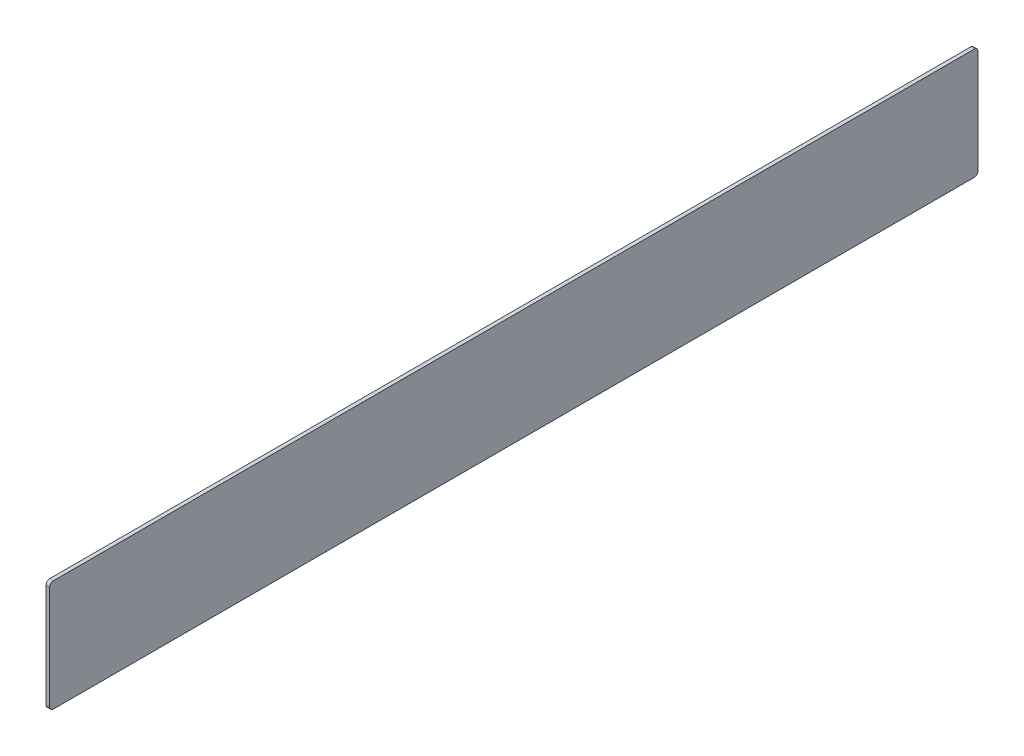
from build123d import *

# Parameters (mm, degrees)
SKETCH1_W           = 500
SKETCH1_H           = 59.85
BOSS_EXTRUDE1_DEPTH = 2
FILLET1_R           = 2


with BuildPart() as part:
    # Sketch1 → Boss-Extrude1 (new body)
    with BuildSketch(Plane(origin=(0, 0, 0), x_dir=(0, 0, -1), z_dir=(1, 0, 0))):
        with Locations((-19.946808511, -110.367553191)):
            Rectangle(SKETCH1_W, SKETCH1_H)
    extrude(amount=BOSS_EXTRUDE1_DEPTH)

    # Fillet1
    fillet1_edges = [part.edges().sort_by_distance(p)[0] for p in [
        (1, -140.292553191, -230.053191489),
        (1, -80.442553191, -230.053191489),
        (1, -140.292553191, 269.946808511),
        (1, -80.442553191, 269.946808511),
    ]]
    fillet(fillet1_edges, radius=FILLET1_R)


solid = part.part
